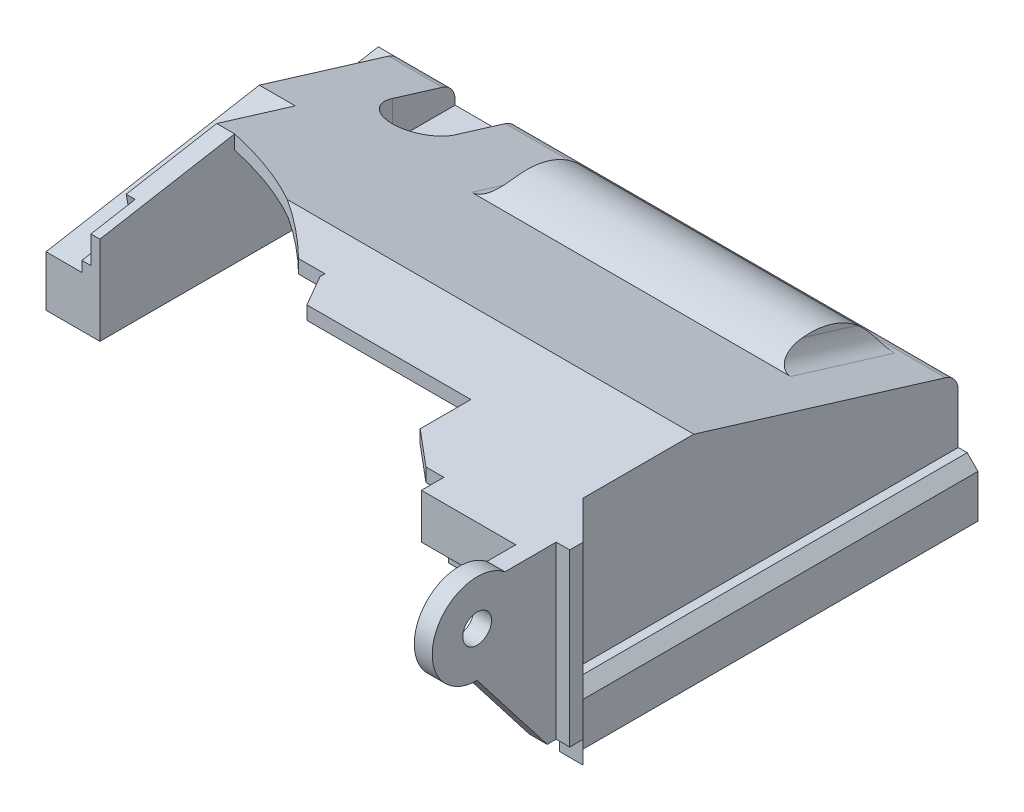
from build123d import *

# Parameters (mm, degrees)
SKETCH_1_R                      = 3.5
SKETCH_1_R_2                    = 1.6
EXTRUDE_1_DEPTH                 = 2
EXTRUDE_2_DEPTH                 = 2
SKETCH_3_W                      = 7
SKETCH_3_H                      = 1.5
EXTRUDE_3_DEPTH                 = 5
EXTRUDE_4_DEPTH                 = 49
CUT_EXTRUDE_1_REACH             = 55.2
SKETCH_5_W                      = 44.5
SKETCH_5_H                      = 4
SKETCH_6_W                      = 1
SKETCH_6_H                      = 7
EXTRUDE_5_DEPTH                 = 47
EXTRUDE_6_DEPTH                 = 1
EXTRUDE_7_DEPTH                 = 8
EXTRUDE_8_DEPTH                 = 27.5
EXTRUDE_START                   = 2
EXTRUDE_9_DEPTH                 = 2
CUT_EXTRUDE_2_REACH             = 71.172
SKETCH_11_W                     = 26.75
SKETCH_11_H                     = 10
EXTRUDE_10_DEPTH                = 19.5
EXTRUDE_11_DEPTH                = 2
EXTRUDE_12_REACH                = 69.989
CUT_EXTRUDE_3_REACH             = 69.989
SKETCH_15_R                     = 1.6
CUT_EXTRUDE_4_REACH             = 71.172
SKETCH_16_W                     = 20
SKETCH_16_H                     = 4
CUT_EXTRUDE_5_REACH             = 71.172
CUT_EXTRUDE_5_DIRECTION_2_REACH = 71.172
CHAMFER_1_SIZE                  = 2
CHAMFER_1_SIZE2                 = 3.464101615
EXTRUDE_13_DEPTH                = 1.5
SKETCH_19_W                     = 3.5
SKETCH_19_H                     = 17.5
EXTRUDE_14_DEPTH                = 2
SKETCH_20_W                     = 3.5
SKETCH_20_H                     = 7
EXTRUDE_15_DEPTH                = 6.75
EXTRUDE_16_DEPTH                = 8
SKETCH_22_W                     = 1.5
SKETCH_22_H                     = 4
EXTRUDE_17_DEPTH                = 3
CHAMFER_2_SIZE                  = 3
CUT_EXTRUDE_6_DEPTH             = 5.5
CUT_EXTRUDE_7_DEPTH             = 2
EXTRUDE_18_DEPTH                = 2
CUT_EXTRUDE_8_DEPTH             = 4
EXTRUDE_19_REACH                = 70.736
SKETCH_27_W                     = 6
SKETCH_27_H                     = 8.878803279
EXTRUDE_20_DEPTH                = 2
EXTRUDE_21_DEPTH                = 6
SKETCH_31_W                     = 2
SKETCH_31_H                     = 6.859975599
EXTRUDE_22_DEPTH                = 15.231399178
CUT_EXTRUDE_9_DEPTH             = 1
EXTRUDE_23_DEPTH                = 1
CUT_EXTRUDE_10_REACH            = 69.82
SKETCH_35_R                     = 3.5
EXTRUDE_24_REACH                = 70.37
EXTRUDE_25_REACH                = 70.37
SKETCH_38_W                     = 4
SKETCH_38_H                     = 19
EXTRUDE_26_DEPTH                = 2.75
SKETCH_39_R                     = 1.6
EXTRUDE_27_DEPTH                = 2
SKETCH_40_W                     = 10.5
SKETCH_40_H                     = 5
EXTRUDE_28_DEPTH                = 1.5
CHAMFER_3_SIZE                  = 2.75
CUT_EXTRUDE_11_REACH            = 80.401
SKETCH_41_W                     = 7
SKETCH_41_H                     = 7
FILLET_2_R                      = 2
EXTRUDE_START_2                 = -17.5
EXTRUDE_29_DEPTH                = 17.5
SKETCH_43_W                     = 3
SKETCH_43_H                     = 19
EXTRUDE_30_DEPTH                = 1.5
CHAMFER_4_SIZE                  = 1.5
EXTRUDE_31_DEPTH                = 2
FILLET_3_R                      = 2
CUT_EXTRUDE_12_DEPTH            = 1.5
EXTRUDE_32_DEPTH                = 3
EXTRUDE_32_DEPTH_BACK           = 3
SKETCH_47_W                     = 2.2
SKETCH_47_H                     = 43.95
CHAMFER_5_SIZE                  = 1.2
SKETCH_48_W                     = 1.1
SKETCH_48_H                     = 42.45
CUT_EXTRUDE_13_DEPTH            = 3
EXTRUDE_33_DEPTH                = 3
SKETCH_50_W                     = 1.6
SKETCH_50_H                     = 2
CUT_EXTRUDE_14_DEPTH            = 3
EXTRUDE_34_DEPTH                = 3


# Some blends are built 0.0001 mm under size
with BuildPart() as part:
    # 草图1 → 凸台-拉伸1 (new body)
    with BuildSketch(Plane(origin=(0, 0, 0), x_dir=(1, 0, 0), z_dir=(0, 1, 0))):
        with Locations(Location((0, 0, 0), (0, 0, 270))):
            Circle(SKETCH_1_R)
        with Locations(Location((0, 0, 0), (0, 0, 270))):
            Circle(SKETCH_1_R_2, mode=Mode.SUBTRACT)
    extrude(amount=EXTRUDE_1_DEPTH)

    # 草图2 → 凸台-拉伸2 (add)
    with BuildSketch(Plane.XZ):
        with BuildLine():
            Line((-3.5, 0), (-3.5, -7))
            Line((-3.5, -7), (3.5, -7))
            Line((3.5, -7), (3.5, 0))
            ThreePointArc((3.5, 0), (0, -3.5), (-3.5, 0))
        make_face()
    extrude(amount=-EXTRUDE_2_DEPTH)

    # 草图3 → 凸台-拉伸3 (add)
    with BuildSketch(Plane.XZ):
        with Locations((0, -6.25)):
            Rectangle(SKETCH_3_W, SKETCH_3_H)
    extrude(amount=EXTRUDE_3_DEPTH)

    # 草图4 → 凸台-拉伸4 (add)
    with BuildSketch(Plane(origin=(3.5, 0, 0), x_dir=(0, 0, -1), z_dir=(1, 0, 0))):
        Polygon((0, 0), (5.5, 0), (5.5, -5), (7, -5), (7, 2), (0, 2), align=None)
    extrude(amount=EXTRUDE_4_DEPTH)

    # 草图5 → 切除-拉伸1 (cut, up to next)
    with BuildSketch(Plane.XZ, mode=Mode.PRIVATE) as cut_extrude_1_sk1:
        with Locations((30.25, -2)):
            Rectangle(SKETCH_5_W, SKETCH_5_H)
    cut_extrude_1_tool1 = extrude(cut_extrude_1_sk1.sketch, amount=-CUT_EXTRUDE_1_REACH, mode=Mode.PRIVATE) & part.part
    add(cut_extrude_1_tool1.solids().sort_by_distance((30.25, 0, -2))[0], mode=Mode.SUBTRACT)

    # 草图6 → 凸台-拉伸5 (add)
    with BuildSketch(Plane.XY.offset(-5.5)):
        with Locations((52, -1.5)):
            Rectangle(SKETCH_6_W, SKETCH_6_H)
    extrude(amount=EXTRUDE_5_DEPTH)

    # 草图7 → 凸台-拉伸6 (add)
    with BuildSketch(Plane(origin=(52.5, 0, 0), x_dir=(0, 0, -1), z_dir=(1, 0, 0))):
        Polygon((-22.437673566, 14), (7, 5), (7, 2), (-41.5, 2), (-41.5, 14), align=None)
    extrude(amount=-EXTRUDE_6_DEPTH)

    # 草图8 → 凸台-拉伸7 (add)
    with BuildSketch(Plane.ZY.offset(-51.5)):
        Polygon((-7, 2), (-7, 5), (22.437673566, 14), (41.5, 14), (41.5, 12.5), (22.661850068, 12.5), (-4, 4.34865441), (-4, 2), align=None)
    extrude(amount=EXTRUDE_7_DEPTH)

    # 草图9 → 凸台-拉伸8 (add)
    with BuildSketch(Plane.ZY.offset(-43.5)):
        with BuildLine():
            Line((5.812409936, 7.348609186), (22.661850068, 12.5))
            Line((22.661850068, 12.5), (41.5, 12.5))
            Line((41.5, 12.5), (41.5, 14))
            Line((41.5, 14), (22.437673566, 14))
            Line((22.437673566, 14), (6.656260181, 9.175137731))
            ThreePointArc((6.656260181, 9.175137731), (0.087933436, 9.938081874), (-4.930823274, 5.63261081))
            Line((-4.930823274, 5.63261081), (-7, 5))
            Line((-7, 5), (-7, 2))
            Line((-7, 2), (-4, 2))
            Line((-4, 2), (-4, 4.34865441))
            Line((-4, 4.34865441), (-3.209857915, 4.590225088))
            ThreePointArc((-3.209857915, 4.590225088), (0.672676845, 8.025472362), (5.812409936, 7.348609186))
        make_face()
    extrude(amount=EXTRUDE_8_DEPTH)

    # 草图10 → 凸台-拉伸9 (add)
    with BuildSketch(Plane(origin=(43.5, 0, 0), x_dir=(0, 0, -1), z_dir=(1, 0, 0)).offset(EXTRUDE_START)):
        with BuildLine():
            Line((-6.656260181, 9.175137731), (4.930823274, 5.63261081))
            ThreePointArc((4.930823274, 5.63261081), (-0.087933436, 9.938081874), (-6.656260181, 9.175137731))
        make_face()
    extrude(amount=-EXTRUDE_9_DEPTH)

    # 草图11 → 切除-拉伸2 (cut, up to next)
    with BuildSketch(Plane.XZ.offset(-12.5), mode=Mode.PRIVATE) as cut_extrude_2_sk1:
        with Locations((29.375, 36.5)):
            Rectangle(SKETCH_11_W, SKETCH_11_H)
    cut_extrude_2_tool1 = extrude(cut_extrude_2_sk1.sketch, amount=-CUT_EXTRUDE_2_REACH, mode=Mode.PRIVATE) & part.part
    add(cut_extrude_2_tool1.solids().sort_by_distance((29.375, 12.5, 36.5))[0], mode=Mode.SUBTRACT)

    # 草图12 → 凸台-拉伸10 (add)
    with BuildSketch(Plane.ZY.offset(-16)):
        Polygon((-7, 2), (-4, 2), (-4, 4.34865441), (22.661850068, 12.5), (31.5, 12.5), (31.5, 14), (22.437673566, 14), (-7, 5), align=None)
    extrude(amount=EXTRUDE_10_DEPTH)

    # 草图13 → 凸台-拉伸11 (add)
    with BuildSketch(Plane.ZY.offset(-16)):
        with BuildLine():
            Line((-4.930823274, 5.63261081), (6.656260181, 9.175137731))
            ThreePointArc((6.656260181, 9.175137731), (0.087933436, 9.938081874), (-4.930823274, 5.63261081))
        make_face()
    extrude(amount=EXTRUDE_11_DEPTH)

    # 凸台-拉伸12: up to this plane
    extrude_12_end = Plane(origin=(43.5, 12.5, 22.661850068), z_dir=(0, 0.9563047559630374, -0.29237170472273066))
    # 草图14 → 凸台-拉伸12 (add, up to the surface)
    with BuildSketch(Plane(origin=(0, 2, 0), x_dir=(1, 0, 0), z_dir=(0, 1, 0)), mode=Mode.PRIVATE) as extrude_12_sk1:
        with BuildLine():
            Line((8, 0), (8, 4))
            Line((8, 4), (-3.5, 4))
            Line((-3.5, 4), (-3.5, 0))
            ThreePointArc((-3.5, 0), (0, -3.5), (3.5, 0))
            Line((3.5, 0), (8, 0))
        make_face()
    extrude_12_tool1 = split(extrude(extrude_12_sk1.sketch, amount=EXTRUDE_12_REACH, mode=Mode.PRIVATE), bisect_by=extrude_12_end, keep=Keep.BOTH, mode=Mode.PRIVATE)
    add(extrude_12_tool1.solids().sort_by_distance((1.586395, 2, -0.972018))[0])

    # 草图15 → 切除-拉伸3 (cut, up to next)
    with BuildSketch(Plane.XZ.offset(-2), mode=Mode.PRIVATE) as cut_extrude_3_sk1:
        with Locations(Location((0, 0, 0), (0, 0, 270))):
            Circle(SKETCH_15_R)
    cut_extrude_3_tool1 = extrude(cut_extrude_3_sk1.sketch, amount=-CUT_EXTRUDE_3_REACH, mode=Mode.PRIVATE) & part.part
    add(cut_extrude_3_tool1.solids().sort_by_distance((0, 2, 0))[0], mode=Mode.SUBTRACT)

    # 草图16 → 切除-拉伸4 (cut, up to next)
    with BuildSketch(Plane.XZ.offset(-12.5), mode=Mode.PRIVATE) as cut_extrude_4_sk1:
        with Locations((6.5, 29.5)):
            Rectangle(SKETCH_16_W, SKETCH_16_H)
    cut_extrude_4_tool1 = extrude(cut_extrude_4_sk1.sketch, amount=-CUT_EXTRUDE_4_REACH, mode=Mode.PRIVATE) & part.part
    add(cut_extrude_4_tool1.solids().sort_by_distance((6.5, 12.5, 29.5))[0], mode=Mode.SUBTRACT)

    # 草图17 → 切除-拉伸5 (cut, up to next)
    with BuildSketch(Plane.XZ.offset(-12.5), mode=Mode.PRIVATE) as cut_extrude_5_sk1:
        with BuildLine():
            Line((13.566884401, 27.5), (-3.5, 27.5))
            Line((-3.5, 27.5), (-3.5, 17.542230954))
            ThreePointArc((-3.5, 17.542230954), (5.657992343, 21.450682428), (13.566884401, 27.5))
        make_face()
    cut_extrude_5_tool1 = extrude(cut_extrude_5_sk1.sketch, amount=-CUT_EXTRUDE_5_REACH, mode=Mode.PRIVATE) & part.part
    add(cut_extrude_5_tool1.solids().sort_by_distance((2.689005, 12.5, 23.843296))[0], mode=Mode.SUBTRACT)

    # 草图17 → 切除-拉伸5 direction 2 (cut, up to next)
    with BuildSketch(Plane.XZ.offset(-12.5), mode=Mode.PRIVATE) as cut_extrude_5_direction_2_sk1:
        with BuildLine():
            Line((13.566884401, 27.5), (-3.5, 27.5))
            Line((-3.5, 27.5), (-3.5, 17.542230954))
            ThreePointArc((-3.5, 17.542230954), (5.657992343, 21.450682428), (13.566884401, 27.5))
        make_face()
    cut_extrude_5_direction_2_tool1 = extrude(cut_extrude_5_direction_2_sk1.sketch, amount=CUT_EXTRUDE_5_DIRECTION_2_REACH, mode=Mode.PRIVATE) & part.part
    add(cut_extrude_5_direction_2_tool1.solids().sort_by_distance((2.689005, 12.5, 23.843296))[0], mode=Mode.SUBTRACT)

    # 倒角1
    chamfer_1_edges = [part.edges().sort_by_distance(p)[0] for p in [
        (16.5, 13.25, 31.5),
    ]]
    chamfer_1_side = [part.faces().sort_by_distance(p)[0] for p in [
        (29.625, 13.25, 31.5),
    ]]
    chamfer(chamfer_1_edges, length=CHAMFER_1_SIZE, length2=CHAMFER_1_SIZE2, reference=chamfer_1_side[0])

    # 草图18 → 凸台-拉伸13 (add)
    with BuildSketch(Plane.XZ.offset(-12.5)):
        Polygon((42.75, 40.5), (40.75, 40.5), (36.75, 37.143601475), (36.75, 31.5), (42.75, 31.5), align=None)
    extrude(amount=-EXTRUDE_13_DEPTH)

    # 草图19 → 凸台-拉伸14 (add)
    with BuildSketch(Plane.ZY.offset(-51.5)):
        with Locations((39.75, 3.75)):
            Rectangle(SKETCH_19_W, SKETCH_19_H)
    extrude(amount=EXTRUDE_14_DEPTH)

    # 草图20 → 凸台-拉伸15 (add)
    with BuildSketch(Plane.ZY.offset(-49.5)):
        with Locations((39.75, 9)):
            Rectangle(SKETCH_20_W, SKETCH_20_H)
    extrude(amount=EXTRUDE_15_DEPTH)

    # 草图21 → 凸台-拉伸16 (add)
    with BuildSketch(Plane.ZY.offset(3.5)):
        Polygon((0, 5.571577135), (17.542230954, 10.934775359), (17.542230954, 12.503312994), (-7, 5), (-7, -5), (-5.5, -5), (-5.5, 0), (0, 0), align=None)
    extrude(amount=EXTRUDE_16_DEPTH)

    # 草图22 → 凸台-拉伸17 (add)
    with BuildSketch(Plane.ZY.offset(11.5)):
        with Locations((-6.25, -3)):
            Rectangle(SKETCH_22_W, SKETCH_22_H)
    extrude(amount=EXTRUDE_17_DEPTH)

    # 倒角2
    chamfer_2_edges = [part.edges().sort_by_distance(p)[0] for p in [
        (-11.5, -1, -6.25),
    ]]
    chamfer(chamfer_2_edges, length=CHAMFER_2_SIZE - 0.0001)  # a hair under: the kernel refuses the full size

    # 草图23 → 切除-拉伸6 (cut)
    with BuildSketch(Plane.XY):
        Polygon((-11.5, 2), (-11.5, 0), (-13.5, 0), align=None)
    extrude(amount=-CUT_EXTRUDE_6_DEPTH, mode=Mode.SUBTRACT)

    # 草图24 → 切除-拉伸7 (cut)
    with BuildSketch(Plane.ZY.offset(11.5)):
        Polygon((-7, 5), (17.542230954, 0.672542516), (17.542230954, 12.503312994), align=None)
    extrude(amount=-CUT_EXTRUDE_7_DEPTH, mode=Mode.SUBTRACT)

    # 草图25 → 凸台-拉伸18 (add)
    with BuildSketch(Plane.ZY.offset(9.5)):
        Polygon((0, 5.571577135), (0, 0), (17.542230954, 0), (17.542230954, 10.934775359), align=None)
    extrude(amount=-EXTRUDE_18_DEPTH)

    # 草图26 → 切除-拉伸8 (cut)
    with BuildSketch(Plane.ZY.offset(9.5)):
        Polygon((8.798316647, 9.830030114), (17.542230954, 8.288242105), (17.542230954, 12.503312994), align=None)
    extrude(amount=-CUT_EXTRUDE_8_DEPTH, mode=Mode.SUBTRACT)

    # 凸台-拉伸19: up to this plane
    extrude_19_end = Plane(origin=(0, 0, 0), z_dir=(0, 1, 0))
    # 草图27 → 凸台-拉伸19 (add, up to the surface)
    with BuildSketch(Plane(origin=(0, 11.038219198, 1.946335864), x_dir=(1, 0, 0), z_dir=(0, 0.9848077530122081, 0.1736481776669299)), mode=Mode.PRIVATE) as extrude_19_sk1:
        with Locations((-6.5, -11.397085271)):
            Rectangle(SKETCH_27_W, SKETCH_27_H)
    extrude_19_tool1 = split(extrude(extrude_19_sk1.sketch, amount=EXTRUDE_19_REACH, dir=(0, -1, 0), mode=Mode.PRIVATE), bisect_by=extrude_19_end, keep=Keep.BOTH, mode=Mode.PRIVATE)
    add(extrude_19_tool1.solids().sort_by_distance((-6.5, 9.059136, 13.170274))[0])

    # 草图28 → 凸台-拉伸20 (add)
    with BuildSketch(Plane.ZY.offset(5.5)):
        Polygon((17.542230954, 12.503312994), (17.542230954, 8.288242105), (8.798316647, 9.830030114), align=None)
    extrude(amount=-EXTRUDE_20_DEPTH)

    # 草图30 → 凸台-拉伸21 (add)
    with BuildSketch(Plane.ZY.offset(9.5)):
        Polygon((17.542230954, 0), (32.542230954, 0), (32.542230954, 5.643337395), (17.542230954, 8.288242105), align=None)
    extrude(amount=-EXTRUDE_21_DEPTH)

    # 草图31 → 凸台-拉伸22 (add, along a direction that is not the sketch's normal)
    with BuildSketch(Plane.XY.offset(17.542230954)):
        with Locations((-4.5, 9.073325195)):
            Rectangle(SKETCH_31_W, SKETCH_31_H)
    extrude(amount=EXTRUDE_22_DEPTH, dir=(0, -0.17364817766692983, 0.9848077530122081))

    # 草图32 → 切除-拉伸9 (cut)
    with BuildSketch(Plane.ZY.offset(5.5)):
        Polygon((27.618192189, 10.726649172), (27.097247656, 7.772225913), (32.542230954, 6.812128448), (32.542230954, 9.858408283), align=None)
    extrude(amount=-CUT_EXTRUDE_9_DEPTH, mode=Mode.SUBTRACT)

    # 草图33 → 凸台-拉伸23 (add)
    with BuildSketch(Plane.ZY.offset(4.5)):
        Polygon((27.270895834, 8.757033666), (31.210126846, 8.062440955), (31.036478668, 7.077633202), (27.097247656, 7.772225913), align=None)
    extrude(amount=EXTRUDE_23_DEPTH)

    # 切除-拉伸10: up to this plane
    cut_extrude_10_end = Plane(origin=(1.537514073, 14, 22.437673566), z_dir=(0, 0.9563047559630374, -0.29237170472273044))
    # 草图35 → 切除-拉伸10 (cut, up to the surface)
    with BuildSketch(Plane(origin=(0, 3, 0), x_dir=(-1, 0, 0), z_dir=(0, -1, 0)), mode=Mode.PRIVATE) as cut_extrude_10_sk1:
        with Locations(Location((0, 0, 0), (0, 0, 90))):
            Circle(SKETCH_35_R)
    cut_extrude_10_tool1 = split(extrude(cut_extrude_10_sk1.sketch, amount=-CUT_EXTRUDE_10_REACH, mode=Mode.PRIVATE), bisect_by=cut_extrude_10_end, keep=Keep.BOTH, mode=Mode.PRIVATE)
    add(cut_extrude_10_tool1.solids().sort_by_distance((0, 3, 0))[0], mode=Mode.SUBTRACT)

    # 凸台-拉伸24: up to this plane
    extrude_24_end = Plane(origin=(43.5, 12.5, 22.661850068), z_dir=(0, 0.9563047559630374, -0.29237170472273066))
    # 草图36 → 凸台-拉伸24 (add, up to the surface)
    with BuildSketch(Plane.XZ, mode=Mode.PRIVATE) as extrude_24_sk1:
        with BuildLine():
            Line((-5.5, 0), (-3.5, 0))
            ThreePointArc((-3.5, 0), (0, 3.5), (3.5, 0))
            Line((3.5, 0), (5.5, 0))
            ThreePointArc((5.5, 0), (0, 5.5), (-5.5, 0))
        make_face()
    extrude_24_tool1 = split(extrude(extrude_24_sk1.sketch, amount=-EXTRUDE_24_REACH, mode=Mode.PRIVATE), bisect_by=extrude_24_end, keep=Keep.BOTH, mode=Mode.PRIVATE)
    add(extrude_24_tool1.solids().sort_by_distance((-4.5, 0, 0.122984))[0])

    # 凸台-拉伸25: up to this plane
    extrude_25_end = Plane(origin=(43.5, 12.5, 22.661850068), z_dir=(0, 0.9563047559630374, -0.29237170472273066))
    # 草图37 → 凸台-拉伸25 (add, up to the surface)
    with BuildSketch(Plane.XZ, mode=Mode.PRIVATE) as extrude_25_sk1:
        with BuildLine():
            Line((-7.5, 5.099019514), (-7.5, 0))
            Line((-7.5, 0), (-5.5, 0))
            ThreePointArc((-5.5, 0), (-5.120221349, 2.008316044), (-4.033333333, 3.739280977))
            ThreePointArc((-4.033333333, 3.739280977), (-6.230296743, 3.237120841), (-7.5, 5.099019514))
        make_face()
    extrude_25_tool1 = split(extrude(extrude_25_sk1.sketch, amount=-EXTRUDE_25_REACH, mode=Mode.PRIVATE), bisect_by=extrude_25_end, keep=Keep.BOTH, mode=Mode.PRIVATE)
    add(extrude_25_tool1.solids().sort_by_distance((-6.381558, 0, 1.877202))[0])
    # 草图37 → 凸台-拉伸25 (add, up to the surface)
    with BuildSketch(Plane.XZ, mode=Mode.PRIVATE) as extrude_25_sk2:
        with BuildLine():
            Line((-7.5, 8.798316647), (-7.5, 6.798316647))
            ThreePointArc((-7.5, 6.798316647), (-6.914213562, 8.21253021), (-5.5, 8.798316647))
            Line((-5.5, 8.798316647), (-7.5, 8.798316647))
        make_face()
    extrude_25_tool2 = split(extrude(extrude_25_sk2.sketch, amount=-EXTRUDE_25_REACH, mode=Mode.PRIVATE), bisect_by=extrude_25_end, keep=Keep.BOTH, mode=Mode.PRIVATE)
    add(extrude_25_tool2.solids().sort_by_distance((-7.053264, 0, 8.351581))[0])
    # 草图37 → 凸台-拉伸25 (add, up to the surface)
    with BuildSketch(Plane.XZ, mode=Mode.PRIVATE) as extrude_25_sk3:
        with BuildLine():
            ThreePointArc((7.228416147, 0), (6.017356006, 0.408355148), (5.300838508, 1.466666667))
            ThreePointArc((5.300838508, 1.466666667), (5.449982192, 0.74006358), (5.5, 0))
            Line((5.5, 0), (7.228416147, 0))
        make_face()
    extrude_25_tool3 = split(extrude(extrude_25_sk3.sketch, amount=-EXTRUDE_25_REACH, mode=Mode.PRIVATE), bisect_by=extrude_25_end, keep=Keep.BOTH, mode=Mode.PRIVATE)
    add(extrude_25_tool3.solids().sort_by_distance((5.871131, 0, 0.326096))[0])

    # 草图38 → 凸台-拉伸26 (add)
    with BuildSketch(Plane(origin=(52.5, 0, 0), x_dir=(0, 0, -1), z_dir=(1, 0, 0))):
        with Locations((-39.5, 4.5)):
            Rectangle(SKETCH_38_W, SKETCH_38_H)
    extrude(amount=EXTRUDE_26_DEPTH)

    # 草图39 → 凸台-拉伸27 (add)
    with BuildSketch(Plane(origin=(55.25, 0, 0), x_dir=(0, 0, -1), z_dir=(1, 0, 0))):
        with BuildLine():
            Line((-41.5, 14), (-46.208867521, 14))
            ThreePointArc((-46.208867521, 14), (-54.024933862, 11.705542723), (-49.3, 5.07))
            Line((-49.3, 5.07), (-41.5, -5))
            Line((-41.5, -5), (-41.5, 14))
        make_face()
        with Locations((-49.3, 10.07)):
            Circle(SKETCH_39_R, mode=Mode.SUBTRACT)
    extrude(amount=-EXTRUDE_27_DEPTH)

    # 草图40 → 凸台-拉伸28 (add)
    with BuildSketch(Plane.XY.offset(41.5)):
        with Locations((48, 11.5)):
            Rectangle(SKETCH_40_W, SKETCH_40_H)
    extrude(amount=EXTRUDE_28_DEPTH)

    # 倒角3
    chamfer_3_edges = [part.edges().sort_by_distance(p)[0] for p in [
        (52.5, 4.5, 37.5),
    ]]
    chamfer(chamfer_3_edges, length=CHAMFER_3_SIZE - 0.0001)  # a hair under: the kernel refuses the full size

    # 切除-拉伸11: up to this plane
    cut_extrude_11_end = Plane(origin=(1.537514073, 14, 22.437673566), z_dir=(0, 0.9563047559630374, -0.29237170472273044))
    # 草图41 → 切除-拉伸11 (cut, up to the surface)
    with BuildSketch(Plane(origin=(0, 3, 0), x_dir=(1, 0, 0), z_dir=(0, 1, 0)), mode=Mode.PRIVATE) as cut_extrude_11_sk1:
        with Locations((0, 3.5)):
            Rectangle(SKETCH_41_W, SKETCH_41_H)
    cut_extrude_11_tool1 = split(extrude(cut_extrude_11_sk1.sketch, amount=CUT_EXTRUDE_11_REACH, mode=Mode.PRIVATE), bisect_by=cut_extrude_11_end, keep=Keep.BOTH, mode=Mode.PRIVATE)
    add(cut_extrude_11_tool1.solids().sort_by_distance((0, 3, -3.5))[0], mode=Mode.SUBTRACT)

    # 圆角2
    fillet_2_edges = [part.edges().sort_by_distance(p)[0] for p in [
        (45.5, 7.403874271, 0.862718454),
        (14, 7.403874271, 0.862718454),
    ]]
    fillet(fillet_2_edges, radius=FILLET_2_R)

    # 草图42 → 凸台-拉伸29 (add)
    with BuildSketch(Plane.XZ.offset(5).offset(EXTRUDE_START_2)):
        Polygon((49.5, 38), (51.5, 36), (51.5, 38), align=None)
    extrude(amount=EXTRUDE_29_DEPTH)

    # 草图43 → 凸台-拉伸30 (add)
    with BuildSketch(Plane(origin=(55.25, 0, 0), x_dir=(0, 0, -1), z_dir=(1, 0, 0))):
        with Locations((-39, 4.5)):
            Rectangle(SKETCH_43_W, SKETCH_43_H)
    extrude(amount=EXTRUDE_30_DEPTH)

    # 倒角4
    chamfer_4_edges = [part.edges().sort_by_distance(p)[0] for p in [
        (56.75, 4.5, 37.5),
    ]]
    chamfer(chamfer_4_edges, length=CHAMFER_4_SIZE)

    # 草图45 → 凸台-拉伸31 (add)
    with BuildSketch(Plane.ZY.offset(9.5)):
        Polygon((0, 3.765711135), (21.356409098, 0), (0, 0), align=None)
    extrude(amount=EXTRUDE_31_DEPTH)

    # 圆角3
    # the kernel refuses this fillet: 2 mm, written as the material it takes off along each edge
    with BuildSketch(Plane(origin=(0.199805375, 5, -7), x_dir=(0, 0.29237170472273, 0.9563047559630375), z_dir=(-1, 0, 0))) as fillet_3_piece_1:
        with BuildLine():
            CenterArc((FILLET_3_R * 0.739961075028, -FILLET_3_R), FILLET_3_R, 90, 73)
            Line((-FILLET_3_R * 0.216343680935, -FILLET_3_R * 0.707628295277), (0, 0))
            Line((0, 0), (FILLET_3_R * 0.739961075028, 0))
        make_face()
    extrude(amount=13.39961075, mode=Mode.SUBTRACT)
    with BuildSketch(Plane(origin=(56.199805375, 5, -7), x_dir=(0, 0.29237170472273, 0.9563047559630375), z_dir=(-1, 0, 0))) as fillet_3_piece_2:
        with BuildLine():
            CenterArc((FILLET_3_R * 0.739961075028, -FILLET_3_R), FILLET_3_R, 90, 73)
            Line((-FILLET_3_R * 0.216343680935, -FILLET_3_R * 0.707628295277), (0, 0))
            Line((0, 0), (FILLET_3_R * 0.739961075028, 0))
        make_face()
    extrude(amount=56.39961075, mode=Mode.SUBTRACT)

    # 草图46 → 切除-拉伸12 (cut)
    with BuildSketch(Plane.XY.offset(41.5)):
        Polygon((53.25, 9), (42.75, 9), (42.75, 5.5), (49.5, 5.5), (49.5, -5), (53.25, -5), align=None)
    extrude(amount=-CUT_EXTRUDE_12_DEPTH, mode=Mode.SUBTRACT)

    # 草图47 → 凸台-拉伸32 (add, two sides: drawn at the far end of the back side and taken through both)
    with BuildSketch(Plane.XZ.offset(5).offset(-EXTRUDE_32_DEPTH_BACK)):
        with Locations((53.6, 14.975)):
            Rectangle(SKETCH_47_W, SKETCH_47_H)
    extrude(amount=EXTRUDE_32_DEPTH + EXTRUDE_32_DEPTH_BACK)

    # 倒角5
    chamfer_5_edges = [part.edges().sort_by_distance(p)[0] for p in [
        (54.7, -2, 14.975),
    ]]
    chamfer(chamfer_5_edges, length=CHAMFER_5_SIZE)

    # 草图48 → 切除-拉伸13 (cut)
    with BuildSketch(Plane.XZ.offset(8)):
        with Locations((53.05, 15.725)):
            Rectangle(SKETCH_48_W, SKETCH_48_H)
    extrude(amount=-CUT_EXTRUDE_13_DEPTH, mode=Mode.SUBTRACT)

    # 草图49 → 凸台-拉伸33 (add)
    with BuildSketch(Plane.XZ.offset(5)):
        Polygon((53.6, 36.95), (55.65, 39), (55.65, 40.5), (56.75, 40.5), (56.75, 39), (54.7, 36.95), align=None)
    extrude(amount=EXTRUDE_33_DEPTH)

    # 草图50 → 切除-拉伸14 (cut)
    with BuildSketch(Plane.XZ.offset(8)):
        with Locations((55.95, 39.5)):
            Rectangle(SKETCH_50_W, SKETCH_50_H)
    extrude(amount=-CUT_EXTRUDE_14_DEPTH, mode=Mode.SUBTRACT)

    # 草图51 → 凸台-拉伸34 (add)
    with BuildSketch(Plane.XZ.offset(5)):
        Polygon((55.15, 38.5), (53.6, 36.95), (53.6, 38.5), align=None)
    extrude(amount=EXTRUDE_34_DEPTH)


solid = part.part
